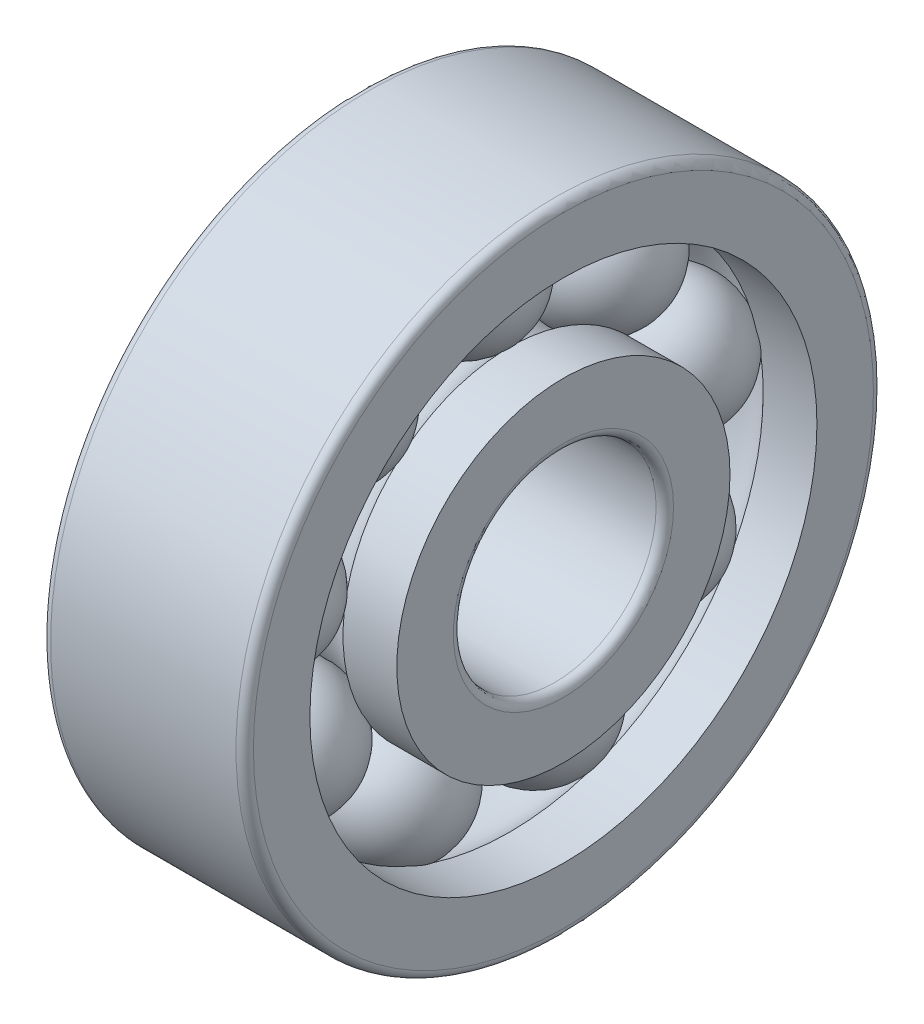
from build123d import *

# Parameters (mm, degrees)
CAGSPISKE_W         = 0.45
CAGSPISKE_H         = 0.75
CAGESPINE_ANGLE     = 0.001
BALLSDETAILED_COUNT = 9
BALLSDETAILED_ANGLE = 320


with BuildPart() as part:
    # CagSpiSke → CageSpine (revolve)
    with BuildSketch(Plane.XY):
        with Locations((0, 7.25)):
            Rectangle(CAGSPISKE_W, CAGSPISKE_H)
    revolve(axis=Axis((-20.6375, 0, 0), (-1, 0, 0)), revolution_arc=CAGESPINE_ANGLE)

    # BalDetSke → BallDetailed (revolve)
    with BuildSketch(Plane.XY):
        with BuildLine():
            Line((-2.25, 7.25), (2.25, 7.25))
            ThreePointArc((2.25, 7.25), (0, 5), (-2.25, 7.25))
        make_face()
    balldetailed = revolve(axis=Axis((-1.905, 7.25, 0), (1, 0, 0)))

    # InnRacSke → InnerRace (revolve)
    with BuildSketch(Plane.XY):
        with BuildLine():
            Line((-1.643357843, 5.75), (-3.5, 5.75))
            Line((-3.5, 5.75), (-3.5, 3.8))
            ThreePointArc((-3.5, 3.8), (-3.412132034, 3.587867966), (-3.2, 3.5))
            Line((-3.2, 3.5), (3.2, 3.5))
            ThreePointArc((3.2, 3.5), (3.412132034, 3.587867966), (3.5, 3.8))
            Line((3.5, 3.8), (3.5, 5.75))
            Line((3.5, 5.75), (1.643357843, 5.75))
            ThreePointArc((1.643357843, 5.75), (0, 5.025), (-1.643357843, 5.75))
        make_face()
    revolve(axis=Axis((-20.6375, 0, 0), (1, 0, 0)))

    # OutRacSke → OuterRace (revolve)
    with BuildSketch(Plane.XY):
        with BuildLine():
            Line((-1.643357843, 8.75), (-3.5, 8.75))
            Line((-3.5, 8.75), (-3.5, 10.7))
            ThreePointArc((-3.5, 10.7), (-3.412132034, 10.912132034), (-3.2, 11))
            Line((-3.2, 11), (3.2, 11))
            ThreePointArc((3.2, 11), (3.412132034, 10.912132034), (3.5, 10.7))
            Line((3.5, 10.7), (3.5, 8.75))
            Line((3.5, 8.75), (1.643357843, 8.75))
            ThreePointArc((1.643357843, 8.75), (0, 9.475), (-1.643357843, 8.75))
        make_face()
    revolve(axis=Axis((-20.6375, 0, 0), (1, 0, 0)))

    # BallsDetailed: BallDetailed ×9 about axis
    ballsdetailed_axis = Axis((-50, 0, 0), (1, 0, 0))
    for i in range(1, BALLSDETAILED_COUNT):
        add(balldetailed.rotate(ballsdetailed_axis, i * BALLSDETAILED_ANGLE / (BALLSDETAILED_COUNT - 1)))


solid = part.part
